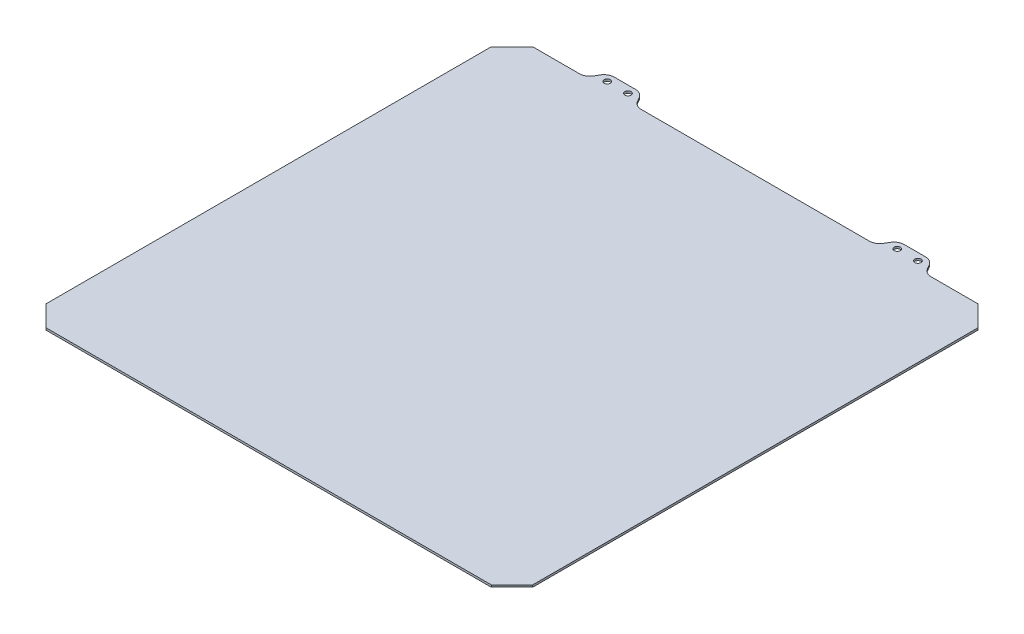
from build123d import *

# Parameters (mm, degrees)
SKETCH1_W           = 235
SKETCH1_H           = 235
BOSS_EXTRUDE1_DEPTH = 1
SKETCH2_R           = 1.5
BOSS_EXTRUDE2_DEPTH = 1
FILLET1_R           = 5
CHAMFER1_SIZE       = 10


with BuildPart() as part:
    # Sketch1 → Boss-Extrude1 (new body)
    with BuildSketch(Plane(origin=(0, 0, 0), x_dir=(1, 0, 0), z_dir=(0, 1, 0))):
        Rectangle(SKETCH1_W, SKETCH1_H)
    extrude(amount=BOSS_EXTRUDE1_DEPTH)

    # Sketch2 → Boss-Extrude2 (add)
    # profile 1 of 2: a face of its own
    with BuildSketch(Plane(origin=(0, 0, 0), x_dir=(1, 0, 0), z_dir=(0, 1, 0))):
        Polygon((-82.041451884, 117.5), (-78, 124.5), (-62, 124.5), (-57.958548116, 117.5), align=None)
        with Locations((-75, 121)):
            Circle(SKETCH2_R, mode=Mode.SUBTRACT)
        with Locations((-65, 121)):
            Circle(SKETCH2_R, mode=Mode.SUBTRACT)
    # profile 2 of 2: a face of its own
    with BuildSketch(Plane(origin=(0, 0, 0), x_dir=(1, 0, 0), z_dir=(0, 1, 0))):
        Polygon((57.958548116, 117.5), (82.041451884, 117.5), (78, 124.5), (62, 124.5), align=None)
        with Locations((65, 121)):
            Circle(SKETCH2_R, mode=Mode.SUBTRACT)
        with Locations((75, 121)):
            Circle(SKETCH2_R, mode=Mode.SUBTRACT)
    extrude(amount=BOSS_EXTRUDE2_DEPTH)

    # Fillet1
    fillet1_edges = [part.edges().sort_by_distance(p)[0] for p in [
        (-78, 0.5, -124.5),
        (-62, 0.5, -124.5),
        (-57.958548116, 0.5, -117.5),
        (57.958548116, 0.5, -117.5),
        (62, 0.5, -124.5),
        (78, 0.5, -124.5),
        (82.041451884, 0.5, -117.5),
        (-82.041451884, 0.5, -117.5),
    ]]
    fillet(fillet1_edges, radius=FILLET1_R)

    # Chamfer1
    chamfer1_edges = [part.edges().sort_by_distance(p)[0] for p in [
        (117.5, 0.5, -117.5),
        (117.5, 0.5, 117.5),
        (-117.5, 0.5, 117.5),
        (-117.5, 0.5, -117.5),
    ]]
    chamfer(chamfer1_edges, length=CHAMFER1_SIZE)


solid = part.part
